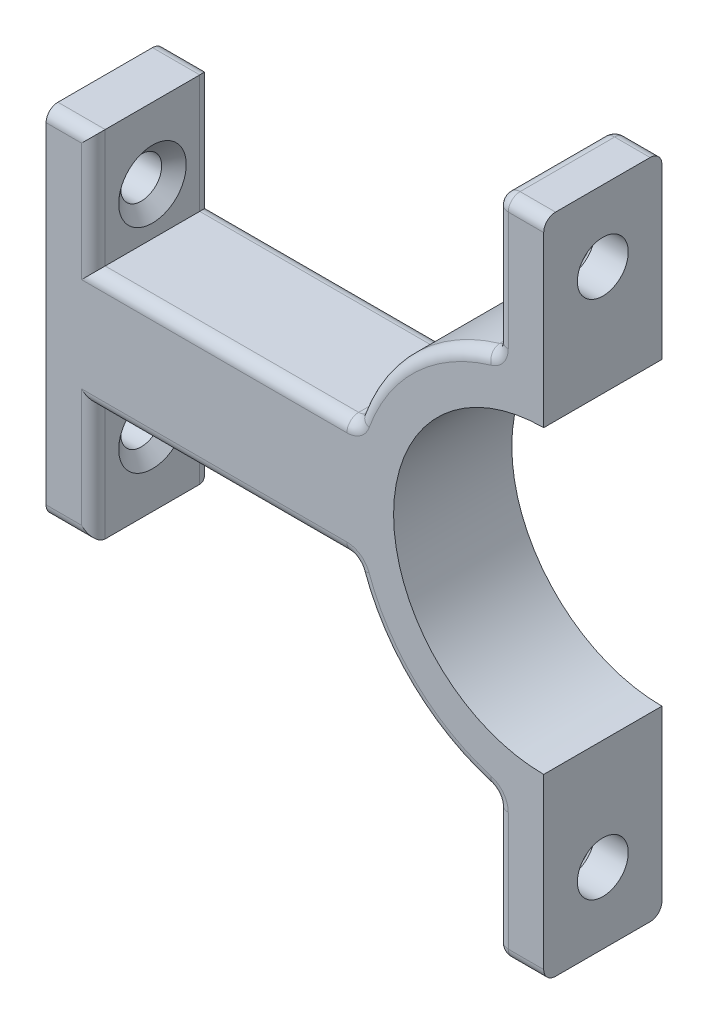
from build123d import *

# Parameters (mm, degrees)
SKETCH1_R                                         = 16.7
SKETCH1_R_2                                       = 12.7
BOSS_EXTRUDE1_DEPTH                               = 10
SKETCH2_W                                         = 22.16607393
SKETCH2_H                                         = 10
SKETCH2_W_2                                       = 4
SKETCH2_H_2                                       = 30
BOSS_EXTRUDE2_DEPTH                               = 10
SKETCH4_W                                         = 8
SKETCH4_H                                         = 11.78611706
BOSS_EXTRUDE3_DEPTH                               = 10
FILLET3_R                                         = 1
CSK_FOR_6_FLAT_HEAD_MACHINE_SCREW_100_D           = 4.3053
CSK_FOR_6_FLAT_HEAD_MACHINE_SCREW_100_CSINK_D     = 7.0866
CSK_FOR_6_FLAT_HEAD_MACHINE_SCREW_100_CSINK_ANGLE = 100
INTERSECT3_OUTLINE_R                              = 2.15265
INTERSECT3_DEPTH                                  = 16.7


# Read off the part's stored shape, not the designer's step: CSK for #4 Flat Head Machine Screw (100)1, Intersect3
with BuildPart() as part:
    # Sketch1 → Boss-Extrude1 (new body)
    with BuildSketch(Plane.XY):
        Circle(SKETCH1_R)
        Circle(SKETCH1_R_2, mode=Mode.SUBTRACT)
    extrude(amount=BOSS_EXTRUDE1_DEPTH)

    # Sketch2 → Boss-Extrude2 (add)
    with BuildSketch(Plane(origin=(0, 0, 0), x_dir=(-1, 0, 0), z_dir=(0, 0, -1))):
        with Locations((27.016963035, 0)):
            Rectangle(SKETCH2_W, SKETCH2_H)
        with Locations((40.1, 0)):
            Rectangle(SKETCH2_W_2, SKETCH2_H_2)
    extrude(amount=-BOSS_EXTRUDE2_DEPTH)

    # Sketch4 → Boss-Extrude3 (add)
    with BuildSketch(Plane(origin=(0, 0, 0), x_dir=(-1, 0, 0), z_dir=(0, 0, -1))):
        with Locations((0, 22.10694147)):
            Rectangle(SKETCH4_W, SKETCH4_H)
    boss_extrude3 = extrude(amount=-BOSS_EXTRUDE3_DEPTH)

    # Mirror1: Boss-Extrude3 across plane
    add(boss_extrude3.mirror(Plane.ZX))

    # Fillet3
    fillet3_edges = [part.edges().sort_by_distance(p)[0] for p in [
        (-11.435827246, -12.170121413, 10),
        (-11.435827246, -12.170121413, 0),
        (-38.1, 10, 10),
        (-40.1, -15, 10),
        (-27.016963035, -5, 10),
        (-38.1, -10, 0),
        (-40.1, 15, 0),
        (-38.1, 10, 0),
        (-27.016963035, 5, 0),
        (-38.1, -10, 10),
        (-40.1, -15, 0),
        (-40.1, 15, 10),
        (-15.93392607, -5, 5),
        (-27.016963035, -5, 0),
        (-27.016963035, 5, 10),
        (-15.93392607, 5, 5),
        (-11.435827246, 12.170121413, 0),
        (-11.435827246, 12.170121413, 10),
        (-4, 22.10694147, 0),
        (0, 28, 0),
        (4, 22.10694147, 0),
        (0, 28, 10),
        (4, 28, 5),
        (4, 22.10694147, 10),
        (4, 16.21388294, 5),
        (-4, 16.21388294, 5),
        (-4, 22.10694147, 10),
        (-4, 28, 5),
        (16.7, 0, 0),
        (16.7, 0, 10),
        (-4, -16.21388294, 5),
        (-4, -22.10694147, 0),
        (-4, -28, 5),
        (0, -28, 0),
        (4, -28, 5),
        (4, -22.10694147, 0),
        (4, -16.21388294, 5),
        (-4, -22.10694147, 10),
        (0, -28, 10),
        (4, -22.10694147, 10),
    ]]
    fillet(fillet3_edges, radius=FILLET3_R)

    # CSK for _4 Flat Head Machine Screw _ 2 → CSK for #4 Flat Head Machine Screw (100)1 (revolve, cut)
    with BuildSketch(Plane(origin=(0, -9, 5), x_dir=(0, 1, 0), z_dir=(0, 0, -1))):
        Polygon((0, -42.1), (1.7272, -42.1), (1.7272, -39.048434313), (2.8575, -38.1), (0, -38.1), align=None)
    csk_for_4_flat_head_machine_screw_100 = revolve(axis=Axis((0, -9, 5), (1, 0, 0)), mode=Mode.SUBTRACT)

    # Mirror2: CSK for #4 Flat Head Machine Screw (100)1 across plane
    add(csk_for_4_flat_head_machine_screw_100.mirror(Plane.ZX), mode=Mode.SUBTRACT)

    # CSK for #6 Flat Head Machine Screw (100)5 (through all)
    with Locations(Plane.ZY.offset(4)):
        with Locations((5, -22)):
            csk_for_6_flat_head_machine_screw_100 = CounterSinkHole(CSK_FOR_6_FLAT_HEAD_MACHINE_SCREW_100_D / 2, CSK_FOR_6_FLAT_HEAD_MACHINE_SCREW_100_CSINK_D / 2, counter_sink_angle=CSK_FOR_6_FLAT_HEAD_MACHINE_SCREW_100_CSINK_ANGLE)

    # Mirror5: CSK for #6 Flat Head Machine Screw (100)5 across plane
    add(csk_for_6_flat_head_machine_screw_100.mirror(Plane.ZX), mode=Mode.SUBTRACT)

    # Intersect3 outline → Intersect3 (cut)
    with BuildSketch(Plane.YZ):
        with BuildLine():
            ThreePointArc((28, 9), (27.707106781, 9.707106781), (27, 10))
            Line((27, 10), (-27, 10))
            ThreePointArc((-27, 10), (-27.707106781, 9.707106781), (-28, 9))
            Line((-28, 9), (-28, 1))
            ThreePointArc((-28, 1), (-27.707106781, 0.292893219), (-27, 0))
            Line((-27, 0), (27, 0))
            ThreePointArc((27, 0), (27.707106781, 0.292893219), (28, 1))
            Line((28, 1), (28, 9))
        make_face()
        with Locations((-22, 5)):
            Circle(INTERSECT3_OUTLINE_R, mode=Mode.SUBTRACT)
        with Locations((22, 5)):
            Circle(INTERSECT3_OUTLINE_R, mode=Mode.SUBTRACT)
    extrude(amount=INTERSECT3_DEPTH, mode=Mode.SUBTRACT)


solid = part.part
